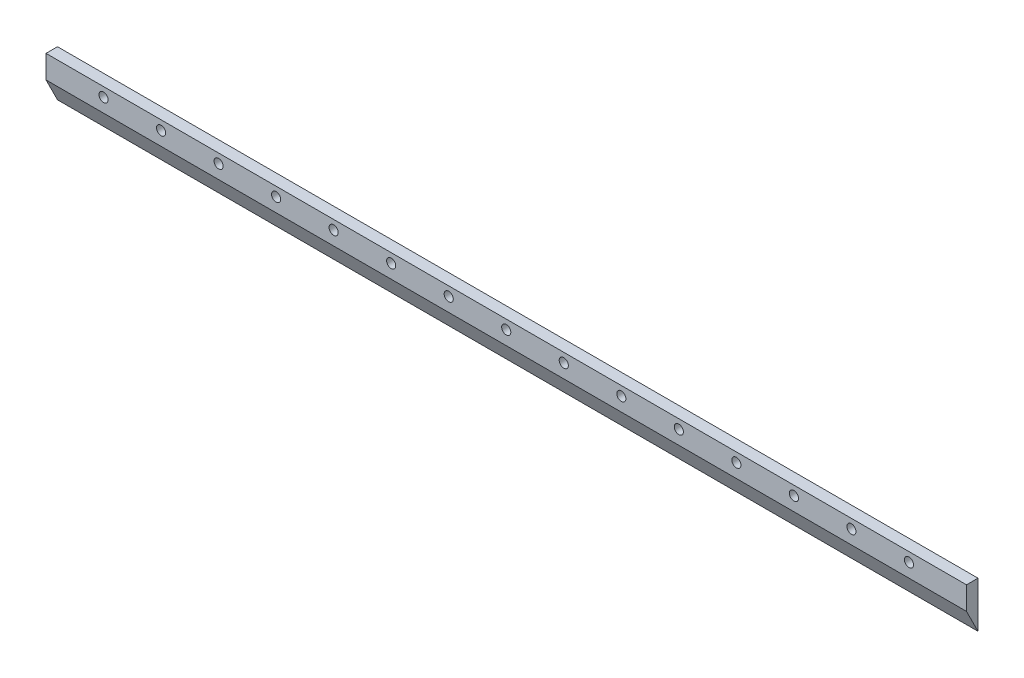
from build123d import *

# Parameters (mm, degrees)
CROQUIS1_W              = 800
CROQUIS1_H              = 40
SALIENTE_EXTRUIR1_DEPTH = 10
CORTAR_EXTRUIR1_DEPTH   = 801.312438989
CROQUIS3_R              = 3.96875
CORTAR_EXTRUIR2_DEPTH   = 10


with BuildPart() as part:
    # Croquis1 → Saliente-Extruir1 (new body)
    with BuildSketch(Plane.XY):
        Rectangle(CROQUIS1_W, CROQUIS1_H)
    extrude(amount=SALIENTE_EXTRUIR1_DEPTH)

    # Croquis2 → Cortar-Extruir1 (cut, through all)
    with BuildSketch(Plane(origin=(400, 0, 0), x_dir=(0, 0, -1), z_dir=(1, 0, 0))):
        Polygon((-10, -20), (0, -20), (-10, 0), align=None)
    extrude(amount=-CORTAR_EXTRUIR1_DEPTH, mode=Mode.SUBTRACT)

    # Croquis3 → Cortar-Extruir2 (cut)
    with BuildSketch(Plane(origin=(0, 0, 0), x_dir=(-1, 0, 0), z_dir=(0, 0, -1))):
        with Locations((-350, 12)):
            Circle(CROQUIS3_R)
        with Locations((-300, 12)):
            Circle(CROQUIS3_R)
        with Locations((-250, 12)):
            Circle(CROQUIS3_R)
        with Locations((-200, 12)):
            Circle(CROQUIS3_R)
        with Locations((-150, 12)):
            Circle(CROQUIS3_R)
        with Locations((-100, 12)):
            Circle(CROQUIS3_R)
        with Locations((-50, 12)):
            Circle(CROQUIS3_R)
        with Locations((0, 12)):
            Circle(CROQUIS3_R)
        with Locations((50, 12)):
            Circle(CROQUIS3_R)
        with Locations((100, 12)):
            Circle(CROQUIS3_R)
        with Locations((150, 12)):
            Circle(CROQUIS3_R)
        with Locations((200, 12)):
            Circle(CROQUIS3_R)
        with Locations((250, 12)):
            Circle(CROQUIS3_R)
        with Locations((300, 12)):
            Circle(CROQUIS3_R)
        with Locations((350, 12)):
            Circle(CROQUIS3_R)
    extrude(amount=-CORTAR_EXTRUIR2_DEPTH, mode=Mode.SUBTRACT)


solid = part.part
